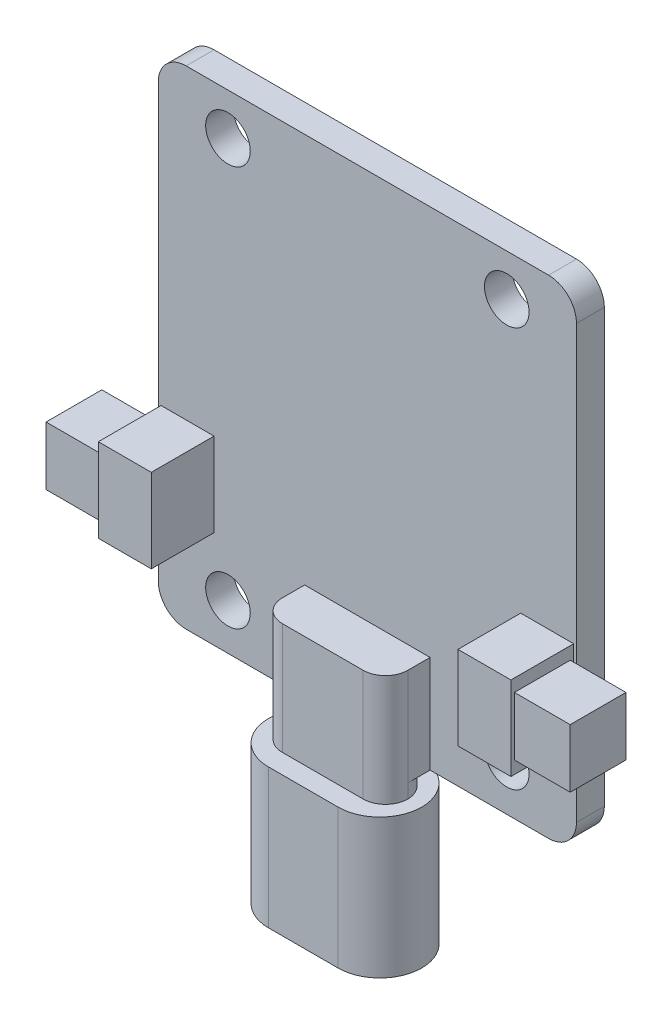
from build123d import *

# Parameters (mm, degrees)
SKETCH_1_W      = 30
SKETCH_1_H      = 35
SKETCH_1_R      = 1.6
EXTRUDE_1_DEPTH = 2
SKETCH_2_W      = 9
SKETCH_2_H      = 8
EXTRUDE_2_DEPTH = 3.2
SKETCH_3_W      = 3.8
SKETCH_3_H      = 6
EXTRUDE_3_DEPTH = 4.5
SKETCH_4_W      = 14
SKETCH_4_H      = 6
EXTRUDE_4_DEPTH = 1.5
FILLET_1_R      = 1.6
FILLET_2_R      = 2
SKETCH_5_W      = 4
SKETCH_5_H      = 4.2
EXTRUDE_5_DEPTH = 4
EXTRUDE_6_DEPTH = 10


with BuildPart() as part:
    # 草图1 → 凸台-拉伸1 (new body)
    with BuildSketch(Plane.XY):
        with Locations((15, 17.5)):
            Rectangle(SKETCH_1_W, SKETCH_1_H)
        with Locations((5, 32)):
            Circle(SKETCH_1_R, mode=Mode.SUBTRACT)
        with Locations((25, 32)):
            Circle(SKETCH_1_R, mode=Mode.SUBTRACT)
        with Locations((5, 3.3)):
            Circle(SKETCH_1_R, mode=Mode.SUBTRACT)
        with Locations((25, 3.3)):
            Circle(SKETCH_1_R, mode=Mode.SUBTRACT)
    extrude(amount=EXTRUDE_1_DEPTH)

    # 草图2 → 凸台-拉伸2 (add)
    with BuildSketch(Plane.XY.offset(2)):
        with Locations((15, 3)):
            Rectangle(SKETCH_2_W, SKETCH_2_H)
    extrude(amount=EXTRUDE_2_DEPTH)

    # 草图3 → 凸台-拉伸3 (add)
    with BuildSketch(Plane.XY.offset(2)):
        with Locations((2.1, 10)):
            Rectangle(SKETCH_3_W, SKETCH_3_H)
        with Locations((27.9, 10)):
            Rectangle(SKETCH_3_W, SKETCH_3_H)
    extrude(amount=EXTRUDE_3_DEPTH)

    # 草图4 → 凸台-拉伸4 (add)
    with BuildSketch(Plane(origin=(0, 0, 0), x_dir=(-1, 0, 0), z_dir=(0, 0, -1))):
        with Locations((-15, 3)):
            Rectangle(SKETCH_4_W, SKETCH_4_H)
    extrude(amount=EXTRUDE_4_DEPTH)

    # 圆角1
    fillet_1_edges = [part.edges().sort_by_distance(p)[0] for p in [
        (19.5, 3, 5.2),
        (19.5, -0.5, 2),
        (10.5, -0.5, 2),
        (10.5, 3, 5.2),
    ]]
    fillet(fillet_1_edges, radius=FILLET_1_R - 0.0001)  # a hair under: the kernel refuses the full size

    # 圆角2
    fillet_2_edges = [part.edges().sort_by_distance(p)[0] for p in [
        (0, 35, 1),
        (30, 35, 1),
        (30, 0, 1),
        (0, 0, 1),
    ]]
    fillet(fillet_2_edges, radius=FILLET_2_R)

    # 草图5 → 凸台-拉伸5 (add)
    with BuildSketch(Plane.ZY.offset(-0.2)):
        with Locations((4.25, 10)):
            Rectangle(SKETCH_5_W, SKETCH_5_H)
    extrude_5 = extrude(amount=EXTRUDE_5_DEPTH)

    # 镜向1: 凸台-拉伸5 across plane
    add(extrude_5.mirror(Plane.ZY.offset(-15)))

    # 草图6 → 凸台-拉伸6 (add)
    with BuildSketch(Plane.XZ.offset(1)):
        with BuildLine():
            Line((17.5, 0.6), (12.5, 0.6))
            ThreePointArc((12.5, 0.6), (9.5, 3.6), (12.5, 6.6))
            Line((12.5, 6.6), (17.5, 6.6))
            ThreePointArc((17.5, 6.6), (20.5, 3.6), (17.5, 0.6))
        make_face()
    extrude(amount=EXTRUDE_6_DEPTH)


solid = part.part
